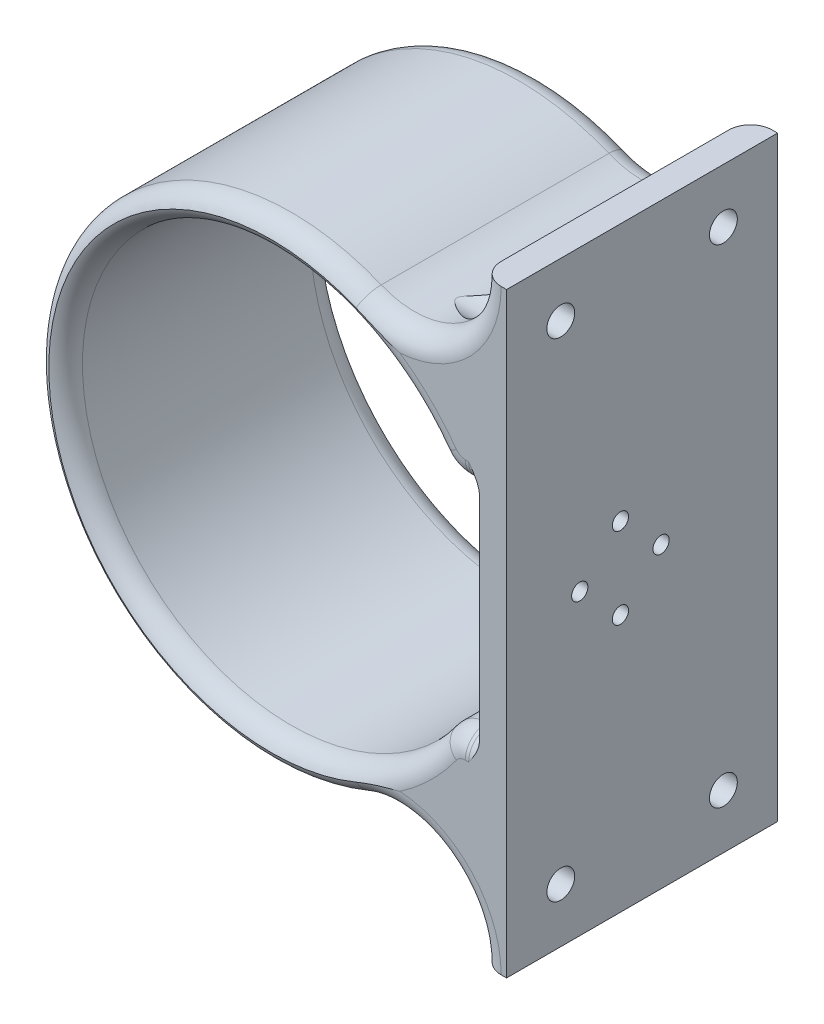
from build123d import *

# Parameters (mm, degrees)
SKETCH1_W           = 6.35
SKETCH1_H           = 139.7
BOSS_EXTRUDE1_DEPTH = 63.5
FILLET1_R           = 33.02
FILLET2_R           = 7.62
FILLET3_R           = 20.32
SKETCH3_R           = 3.2639
CUT_EXTRUDE1_DEPTH  = 33.02
FILLET4_R           = 5.08
FILLET5_R           = 5.08
FILLET6_R           = 2.54
CUT_EXTRUDE2_REACH  = 147.566
SKETCH6_R           = 1.905
SKETCH8_R           = 7.5184
SKETCH8_R_2         = 3.2639
CUT_EXTRUDE3_DEPTH  = 20.32


with BuildPart() as part:
    # Sketch1 → Boss-Extrude1 (new body)
    # profile 1 of 2: a face of its own
    with BuildSketch(Plane.XY):
        with BuildLine():
            Line((45.210037879, 31.75), (55.5625, 31.75))
            Line((55.5625, 31.75), (55.5625, -31.75))
            Line((55.5625, -31.75), (45.210037879, -31.75))
            ThreePointArc((45.210037879, -31.75), (-55.245, 0), (45.210037879, 31.75))
        make_face()
        with BuildLine():
            Line((41.77991174, -25.4), (49.2125, -25.4))
            Line((49.2125, -25.4), (49.2125, 25.4))
            Line((49.2125, 25.4), (41.77991174, 25.4))
            ThreePointArc((41.77991174, 25.4), (-48.895, 0), (41.77991174, -25.4))
        make_face(mode=Mode.SUBTRACT)
    # profile 2 of 2: a face of its own
    with BuildSketch(Plane.XY):
        with Locations((52.3875, 0)):
            Rectangle(SKETCH1_W, SKETCH1_H)
    extrude(amount=BOSS_EXTRUDE1_DEPTH)

    # Fillet1
    # the kernel refuses this fillet: 33.02 mm, written as the material it adds along each edge
    with BuildSketch(Plane(origin=(45.210037879, 31.75, 0), x_dir=(1, 0, 0), z_dir=(0, 0, 1))) as fillet1_piece_1:
        with BuildLine():
            CenterArc((17.908412772, 29.949038991), FILLET1_R, 224.34846637, 20.745128528)
            Line((-5.704245025, 6.867384117), (-6.176498181, 6.405751019))
            ThreePointArc((-6.176498181, 6.405751019), (-3.221184862, 3.12713835), (-0.540441832, -0.37954023))
            Line((-0.540441832, -0.37954023), (0, -0.6604))
            ThreePointArc((0, -0.6604), (2.001231061, -0.6604), (3.724343108, -0.59898078))
            Line((3.724343108, -0.59898078), (4.002462121, 0))
        make_face()
    extrude(amount=63.5)
    with BuildSketch(Plane(origin=(45.210037879, -31.75, 0), x_dir=(-0.6389556459125703, -0.7692435781704325, 0), z_dir=(0, 0, 1))) as fillet1_piece_2:
        with BuildLine():
            CenterArc((11.595424466, 32.912039073), FILLET1_R, 244.620393757, 20.745128528)
            Line((-2.55739577, 3.078868284), (-2.840452175, 2.482204868))
            ThreePointArc((-2.840452175, 2.482204868), (-1.786706344, 1.117467833), (-0.508008459, -0.421966309))
            Line((-0.508008459, -0.421966309), (0.053359475, -0.658240781))
            ThreePointArc((0.053359475, -0.658240781), (4.463725348, -0.479773065), (8.87409122, -0.658240781))
            Line((8.87409122, -0.658240781), (8.927450695, 0))
        make_face()
    extrude(amount=63.5)

    # Fillet2
    fillet2_edges = [part.edges().sort_by_distance(p)[0] for p in [
        (41.77991174, -25.4, 31.75),
        (41.77991174, 25.4, 31.75),
    ]]
    fillet(fillet2_edges, radius=FILLET2_R)

    # Fillet3
    # the kernel refuses this fillet: 20.32 mm, written as the material it adds along each edge
    with BuildSketch(Plane(origin=(49.2125, 31.75, 0), x_dir=(-0.8242362187293747, 0.5662461088031443, 0), z_dir=(0, 0, 1)), Plane(origin=(49.2125, -31.75, 63.5), x_dir=(-0.8242362187293752, -0.5662461088031435, 0), z_dir=(0, 0, -1))) as fillet3_piece_1:
        with BuildLine():
            CenterArc((38.307335692, -19.875268625), FILLET3_R, 102.009362536, 112.479505609)
            Line((21.558855727, -31.381389556), (19.884007731, -32.532001649))
            Line((19.884007731, -32.532001649), (-1.674847996, -1.150612093))
            Line((-1.674847996, -1.150612093), (-0.338260837, 2.003647575))
            ThreePointArc((-0.338260837, 2.003647575), (12.282634391, 1.829596067), (33.656520981, 1.987526862))
            Line((33.656520981, 1.987526862), (34.079322319, 0))
        make_face()
    extrude(amount=63.5)

    # Sketch3 → Cut-Extrude1 (cut)
    with BuildSketch(Plane(origin=(55.5625, 0, 0), x_dir=(0, 0, -1), z_dir=(1, 0, 0))):
        with Locations((-50.8, -57.15)):
            Circle(SKETCH3_R)
        with Locations((-12.7, -57.15)):
            Circle(SKETCH3_R)
        with Locations((-12.7, 57.15)):
            Circle(SKETCH3_R)
        with Locations((-50.8, 57.15)):
            Circle(SKETCH3_R)
    extrude(amount=-CUT_EXTRUDE1_DEPTH, mode=Mode.SUBTRACT)

    # Fillet4
    # the kernel refuses this fillet: 5.08 mm, written as the material it takes off along each edge
    with BuildSketch(Plane(origin=(49.2125, 25.4, 0), x_dir=(0, 1, 0), z_dir=(-1, 0, 0)), Plane(origin=(45.865289981, -25.4, 0), x_dir=(0, -1, 0), z_dir=(1, 0, 0))) as fillet4_piece_1:
        with BuildLine():
            CenterArc((FILLET4_R, -FILLET4_R), FILLET4_R, 90, 90)
            Line((0, -FILLET4_R), (0, 0))
            Line((0, 0), (FILLET4_R, 0))
        make_face()
    extrude(amount=3.347210019, mode=Mode.SUBTRACT)
    with BuildSketch(Plane(origin=(45.865289981, 33.02, 0), x_dir=(-0.8115595856064873, -0.5842696629213487, 0), z_dir=(-0.5842696629213487, 0.8115595856064873, 0))) as fillet4_piece_2:
        with BuildLine():
            CenterArc((7.62 - FILLET4_R, FILLET4_R), FILLET4_R, 270, 90)
            Line((7.62, FILLET4_R), (7.62, 0))
            Line((7.62, 0), (7.62 - FILLET4_R, 0))
        make_face()
    revolve(axis=Axis((45.865289981, 33.02, 0), (0, 0, 1)), revolution_arc=54.248588212, mode=Mode.SUBTRACT)
    with BuildSketch(Plane(origin=(45.865289981, -33.02, 0), x_dir=(0, 1, 0), z_dir=(1, 0, 0))) as fillet4_piece_3:
        with BuildLine():
            CenterArc((7.62 - FILLET4_R, FILLET4_R), FILLET4_R, 270, 90)
            Line((7.62, FILLET4_R), (7.62, 0))
            Line((7.62, 0), (7.62 - FILLET4_R, 0))
        make_face()
    revolve(axis=Axis((45.865289981, -33.02, 0), (0, 0, 1)), revolution_arc=54.248588212, mode=Mode.SUBTRACT)
    with BuildSketch(Plane(origin=(49.2125, 69.823296032, 0), x_dir=(1, 0, 0), z_dir=(0, 1, 0)), Plane(origin=(49.2125, -82.55, 0), x_dir=(1, 0, 0), z_dir=(0, 1, 0))) as fillet4_piece_4:
        with BuildLine():
            CenterArc((FILLET4_R, -FILLET4_R), FILLET4_R, 90, 90)
            Line((0, -FILLET4_R), (0, 0))
            Line((0, 0), (FILLET4_R, 0))
        make_face()
    extrude(amount=12.726703968, mode=Mode.SUBTRACT)
    with BuildSketch(Plane(origin=(28.8925, 69.823296032, 0), x_dir=(-0.38235294117655755, -0.9240163572002585, 0), z_dir=(-0.9240163572002585, 0.38235294117655755, 0))) as fillet4_piece_5:
        with BuildLine():
            CenterArc((20.32 + FILLET4_R, FILLET4_R), FILLET4_R, 180, 90)
            Line((20.32, FILLET4_R), (20.32, 0))
            Line((20.32, 0), (20.32 + FILLET4_R, 0))
        make_face()
    revolve(axis=Axis((28.8925, 69.823296032, 0), (0, 0, 1)), revolution_arc=112.479505609, mode=Mode.SUBTRACT)
    with BuildSketch(Plane(origin=(28.8925, -69.823296032, 0), x_dir=(-0.38235294117655755, 0.9240163572002585, 0), z_dir=(-0.9240163572002585, -0.38235294117655755, 0))) as fillet4_piece_6:
        with BuildLine():
            CenterArc((20.32 + FILLET4_R, -FILLET4_R), FILLET4_R, 90, 90)
            Line((20.32 + FILLET4_R, 0), (20.32, 0))
            Line((20.32, 0), (20.32, -FILLET4_R))
        make_face()
    revolve(axis=Axis((28.8925, -69.823296032, 0), (0, 0, -1)), revolution_arc=112.479505609, mode=Mode.SUBTRACT)
    with BuildSketch(Plane(origin=(0, 0, 0), x_dir=(0.8115595856064876, 0.5842696629213486, 0), z_dir=(0.5842696629213486, -0.8115595856064876, 0))) as fillet4_piece_7:
        with BuildLine():
            CenterArc((48.895 + FILLET4_R, FILLET4_R), FILLET4_R, 180, 90)
            Line((48.895, FILLET4_R), (48.895, 0))
            Line((48.895, 0), (48.895 + FILLET4_R, 0))
        make_face()
    revolve(axis=Axis((0, 0, 0), (0, 0, 1)), revolution_arc=288.497176425, mode=Mode.SUBTRACT)
    with BuildSketch(Plane(origin=(0, 0, 0), x_dir=(0.382352941176475, -0.9240163572002927, 0), z_dir=(0.9240163572002927, 0.382352941176475, 0))) as fillet4_piece_8:
        with BuildLine():
            CenterArc((55.245 - FILLET4_R, -FILLET4_R), FILLET4_R, 0, 90)
            Line((55.245 - FILLET4_R, 0), (55.245, 0))
            Line((55.245, 0), (55.245, -FILLET4_R))
        make_face()
    revolve(axis=Axis((0, 0, 0), (0, 0, -1)), revolution_arc=224.959011219, mode=Mode.SUBTRACT)

    # Fillet5
    # the kernel refuses this fillet: 5.08 mm, written as the material it takes off along each edge
    with BuildSketch(Plane(origin=(49.2125, 25.4, 63.5), x_dir=(0, 1, 0), z_dir=(-1, 0, 0)), Plane(origin=(45.865289981, -25.4, 63.5), x_dir=(0, -1, 0), z_dir=(1, 0, 0))) as fillet5_piece_1:
        with BuildLine():
            CenterArc((FILLET5_R, FILLET5_R), FILLET5_R, 180, 90)
            Line((0, FILLET5_R), (0, 0))
            Line((0, 0), (FILLET5_R, 0))
        make_face()
    extrude(amount=3.347210019, mode=Mode.SUBTRACT)
    with BuildSketch(Plane(origin=(45.865289981, 33.02, 63.5), x_dir=(-0.8115595856064873, -0.5842696629213487, 0), z_dir=(-0.5842696629213487, 0.8115595856064873, 0))) as fillet5_piece_2:
        with BuildLine():
            CenterArc((7.62 - FILLET5_R, -FILLET5_R), FILLET5_R, 0, 90)
            Line((7.62, -FILLET5_R), (7.62, 0))
            Line((7.62, 0), (7.62 - FILLET5_R, 0))
        make_face()
    revolve(axis=Axis((45.865289981, 33.02, 63.5), (0, 0, 1)), revolution_arc=54.248588212, mode=Mode.SUBTRACT)
    with BuildSketch(Plane(origin=(45.865289981, -33.02, 63.5), x_dir=(0, 1, 0), z_dir=(1, 0, 0))) as fillet5_piece_3:
        with BuildLine():
            CenterArc((7.62 - FILLET5_R, -FILLET5_R), FILLET5_R, 0, 90)
            Line((7.62, -FILLET5_R), (7.62, 0))
            Line((7.62, 0), (7.62 - FILLET5_R, 0))
        make_face()
    revolve(axis=Axis((45.865289981, -33.02, 63.5), (0, 0, 1)), revolution_arc=54.248588212, mode=Mode.SUBTRACT)
    with BuildSketch(Plane(origin=(49.2125, 69.823296032, 63.5), x_dir=(1, 0, 0), z_dir=(0, 1, 0)), Plane(origin=(49.2125, -82.55, 63.5), x_dir=(1, 0, 0), z_dir=(0, 1, 0))) as fillet5_piece_4:
        with BuildLine():
            CenterArc((FILLET5_R, FILLET5_R), FILLET5_R, 180, 90)
            Line((0, FILLET5_R), (0, 0))
            Line((0, 0), (FILLET5_R, 0))
        make_face()
    extrude(amount=12.726703968, mode=Mode.SUBTRACT)
    with BuildSketch(Plane(origin=(28.8925, 69.823296032, 63.5), x_dir=(-0.38235294117655755, -0.9240163572002585, 0), z_dir=(-0.9240163572002585, 0.38235294117655755, 0))) as fillet5_piece_5:
        with BuildLine():
            CenterArc((20.32 + FILLET5_R, -FILLET5_R), FILLET5_R, 90, 90)
            Line((20.32, -FILLET5_R), (20.32, 0))
            Line((20.32, 0), (20.32 + FILLET5_R, 0))
        make_face()
    revolve(axis=Axis((28.8925, 69.823296032, 63.5), (0, 0, 1)), revolution_arc=112.479505609, mode=Mode.SUBTRACT)
    with BuildSketch(Plane(origin=(28.8925, -69.823296032, 63.5), x_dir=(-0.38235294117655755, 0.9240163572002585, 0), z_dir=(-0.9240163572002585, -0.38235294117655755, 0))) as fillet5_piece_6:
        with BuildLine():
            CenterArc((20.32 + FILLET5_R, FILLET5_R), FILLET5_R, 180, 90)
            Line((20.32 + FILLET5_R, 0), (20.32, 0))
            Line((20.32, 0), (20.32, FILLET5_R))
        make_face()
    revolve(axis=Axis((28.8925, -69.823296032, 63.5), (0, 0, -1)), revolution_arc=112.479505609, mode=Mode.SUBTRACT)
    with BuildSketch(Plane(origin=(0, 0, 63.5), x_dir=(0.8115595856064876, 0.5842696629213486, 0), z_dir=(0.5842696629213486, -0.8115595856064876, 0))) as fillet5_piece_7:
        with BuildLine():
            CenterArc((48.895 + FILLET5_R, -FILLET5_R), FILLET5_R, 90, 90)
            Line((48.895, -FILLET5_R), (48.895, 0))
            Line((48.895, 0), (48.895 + FILLET5_R, 0))
        make_face()
    revolve(axis=Axis((0, 0, 63.5), (0, 0, 1)), revolution_arc=288.497176425, mode=Mode.SUBTRACT)
    with BuildSketch(Plane(origin=(0, 0, 63.5), x_dir=(0.382352941176475, -0.9240163572002927, 0), z_dir=(0.9240163572002927, 0.382352941176475, 0))) as fillet5_piece_8:
        with BuildLine():
            CenterArc((55.245 - FILLET5_R, FILLET5_R), FILLET5_R, 270, 90)
            Line((55.245, FILLET5_R), (55.245, 0))
            Line((55.245, 0), (55.245 - FILLET5_R, 0))
        make_face()
    revolve(axis=Axis((0, 0, 63.5), (0, 0, -1)), revolution_arc=224.959011219, mode=Mode.SUBTRACT)

    # Fillet6
    # the kernel refuses this fillet: 2.54 mm, written as the material it adds along each edge
    with BuildSketch(Plane(origin=(49.2125, 30.48, 5.08), x_dir=(0, 0.9491428341660836, -0.3148458040869757), z_dir=(0, 0.3148458040869757, 0.9491428341660836))) as fillet6_piece_1_section:
        with BuildLine():
            CenterArc((5.08 + FILLET6_R, FILLET6_R), FILLET6_R, 180, 90)
            Line((5.08, FILLET6_R), (5.08, 0))
            Line((5.08, 0), (5.08 + FILLET6_R, 0))
        make_face()
    fillet6_piece_1 = revolve(axis=Axis((49.2125, 30.48, 5.08), (-1, 0, 0)), revolution_arc=161.648494619, mode=Mode.PRIVATE)
    fillet6_piece_1 = split(fillet6_piece_1, bisect_by=Plane(origin=(49.2125, 30.48, 0), z_dir=(0, 0, 1)), keep=Keep.TOP, mode=Mode.PRIVATE)
    add(fillet6_piece_1)
    with BuildSketch(Plane(origin=(49.2125, -30.48, 5.08), x_dir=(0, -0.949142834166083, -0.3148458040869774), z_dir=(0, -0.3148458040869774, 0.949142834166083))) as fillet6_piece_2_section:
        with BuildLine():
            CenterArc((5.08 + FILLET6_R, -FILLET6_R), FILLET6_R, 90, 90)
            Line((5.08, -FILLET6_R), (5.08, 0))
            Line((5.08, 0), (5.08 + FILLET6_R, 0))
        make_face()
    fillet6_piece_2 = revolve(axis=Axis((49.2125, -30.48, 5.08), (1, 0, 0)), revolution_arc=161.648494619, mode=Mode.PRIVATE)
    fillet6_piece_2 = split(fillet6_piece_2, bisect_by=Plane(origin=(49.2125, -30.48, 0), z_dir=(0, 0, 1)), keep=Keep.TOP, mode=Mode.PRIVATE)
    add(fillet6_piece_2)
    with BuildSketch(Plane(origin=(49.2125, 25.4, 5.08), x_dir=(0, -1, 0), z_dir=(0, 0, 1))) as fillet6_piece_3:
        with BuildLine():
            CenterArc((FILLET6_R, -FILLET6_R), FILLET6_R, 90, 90)
            Line((0, -FILLET6_R), (0, 0))
            Line((0, 0), (FILLET6_R, 0))
        make_face()
    extrude(amount=53.34)
    with BuildSketch(Plane(origin=(49.2125, -25.4, 5.08), x_dir=(0, 1, 0), z_dir=(0, 0, 1))) as fillet6_piece_4:
        with BuildLine():
            CenterArc((FILLET6_R, FILLET6_R), FILLET6_R, 180, 90)
            Line((0, FILLET6_R), (0, 0))
            Line((0, 0), (FILLET6_R, 0))
        make_face()
    extrude(amount=53.34)
    with BuildSketch(Plane(origin=(49.2125, 30.48, 58.42), x_dir=(0, -1, 0), z_dir=(0, 0, -1))) as fillet6_piece_5_section:
        with BuildLine():
            CenterArc((5.08 + FILLET6_R, FILLET6_R), FILLET6_R, 180, 90)
            Line((5.08, FILLET6_R), (5.08, 0))
            Line((5.08, 0), (5.08 + FILLET6_R, 0))
        make_face()
    fillet6_piece_5 = revolve(axis=Axis((49.2125, 30.48, 58.42), (-1, 0, 0)), revolution_arc=161.648494619, mode=Mode.PRIVATE)
    fillet6_piece_5 = split(fillet6_piece_5, bisect_by=Plane(origin=(49.2125, 30.48, 63.5), z_dir=(0, 0, -1)), keep=Keep.TOP, mode=Mode.PRIVATE)
    add(fillet6_piece_5)
    with BuildSketch(Plane(origin=(49.2125, -30.48, 58.42), x_dir=(0, 1, 0), z_dir=(0, 0, -1))) as fillet6_piece_6_section:
        with BuildLine():
            CenterArc((5.08 + FILLET6_R, -FILLET6_R), FILLET6_R, 90, 90)
            Line((5.08 + FILLET6_R, 0), (5.08, 0))
            Line((5.08, 0), (5.08, -FILLET6_R))
        make_face()
    fillet6_piece_6 = revolve(axis=Axis((49.2125, -30.48, 58.42), (1, 0, 0)), revolution_arc=161.648494619, mode=Mode.PRIVATE)
    fillet6_piece_6 = split(fillet6_piece_6, bisect_by=Plane(origin=(49.2125, -30.48, 63.5), z_dir=(0, 0, -1)), keep=Keep.TOP, mode=Mode.PRIVATE)
    add(fillet6_piece_6)

    # Sketch6 → Cut-Extrude2 (cut, up to next)
    with BuildSketch(Plane(origin=(55.5625, 0, 0), x_dir=(0, 0, -1), z_dir=(1, 0, 0)), mode=Mode.PRIVATE) as cut_extrude2_sk1:
        with Locations((-46.355, 0)):
            Circle(SKETCH6_R)
    cut_extrude2_tool1 = extrude(cut_extrude2_sk1.sketch, amount=-CUT_EXTRUDE2_REACH, mode=Mode.PRIVATE) & part.part
    # Sketch6 → Cut-Extrude2 (cut, up to next)
    with BuildSketch(Plane(origin=(55.5625, 0, 0), x_dir=(0, 0, -1), z_dir=(1, 0, 0)), mode=Mode.PRIVATE) as cut_extrude2_sk2:
        with Locations((-36.83, 9.525)):
            Circle(SKETCH6_R)
    cut_extrude2_tool2 = extrude(cut_extrude2_sk2.sketch, amount=-CUT_EXTRUDE2_REACH, mode=Mode.PRIVATE) & part.part
    # Sketch6 → Cut-Extrude2 (cut, up to next)
    with BuildSketch(Plane(origin=(55.5625, 0, 0), x_dir=(0, 0, -1), z_dir=(1, 0, 0)), mode=Mode.PRIVATE) as cut_extrude2_sk3:
        with Locations((-27.305, 0)):
            Circle(SKETCH6_R)
    cut_extrude2_tool3 = extrude(cut_extrude2_sk3.sketch, amount=-CUT_EXTRUDE2_REACH, mode=Mode.PRIVATE) & part.part
    # Sketch6 → Cut-Extrude2 (cut, up to next)
    with BuildSketch(Plane(origin=(55.5625, 0, 0), x_dir=(0, 0, -1), z_dir=(1, 0, 0)), mode=Mode.PRIVATE) as cut_extrude2_sk4:
        with Locations((-36.83, -9.525)):
            Circle(SKETCH6_R)
    cut_extrude2_tool4 = extrude(cut_extrude2_sk4.sketch, amount=-CUT_EXTRUDE2_REACH, mode=Mode.PRIVATE) & part.part
    add(cut_extrude2_tool1.solids().sort_by_distance((55.5625, 0, 46.355))[0], mode=Mode.SUBTRACT)
    add(cut_extrude2_tool2.solids().sort_by_distance((55.5625, 9.525, 36.83))[0], mode=Mode.SUBTRACT)
    add(cut_extrude2_tool3.solids().sort_by_distance((55.5625, 0, 27.305))[0], mode=Mode.SUBTRACT)
    add(cut_extrude2_tool4.solids().sort_by_distance((55.5625, -9.525, 36.83))[0], mode=Mode.SUBTRACT)

    # Sketch8 → Cut-Extrude3 (cut)
    # profile 1 of 4: a face of its own
    with BuildSketch(Plane(origin=(49.2125, 0, 0), x_dir=(0, 0, -1), z_dir=(1, 0, 0))):
        with Locations((-50.8, 57.15)):
            Circle(SKETCH8_R)
        with Locations((-50.8, 57.15)):
            Circle(SKETCH8_R_2, mode=Mode.SUBTRACT)
    # profile 2 of 4: a face of its own
    with BuildSketch(Plane(origin=(49.2125, 0, 0), x_dir=(0, 0, -1), z_dir=(1, 0, 0))):
        with Locations((-12.7, 57.15)):
            Circle(SKETCH8_R)
        with Locations((-12.7, 57.15)):
            Circle(SKETCH8_R_2, mode=Mode.SUBTRACT)
    # profile 3 of 4: a face of its own
    with BuildSketch(Plane(origin=(49.2125, 0, 0), x_dir=(0, 0, -1), z_dir=(1, 0, 0))):
        with Locations((-12.7, -57.15)):
            Circle(SKETCH8_R)
        with Locations((-12.7, -57.15)):
            Circle(SKETCH8_R_2, mode=Mode.SUBTRACT)
    # profile 4 of 4: a face of its own
    with BuildSketch(Plane(origin=(49.2125, 0, 0), x_dir=(0, 0, -1), z_dir=(1, 0, 0))):
        with Locations((-50.8, -57.15)):
            Circle(SKETCH8_R)
        with Locations((-50.8, -57.15)):
            Circle(SKETCH8_R_2, mode=Mode.SUBTRACT)
    extrude(amount=-CUT_EXTRUDE3_DEPTH, mode=Mode.SUBTRACT)


solid = part.part
